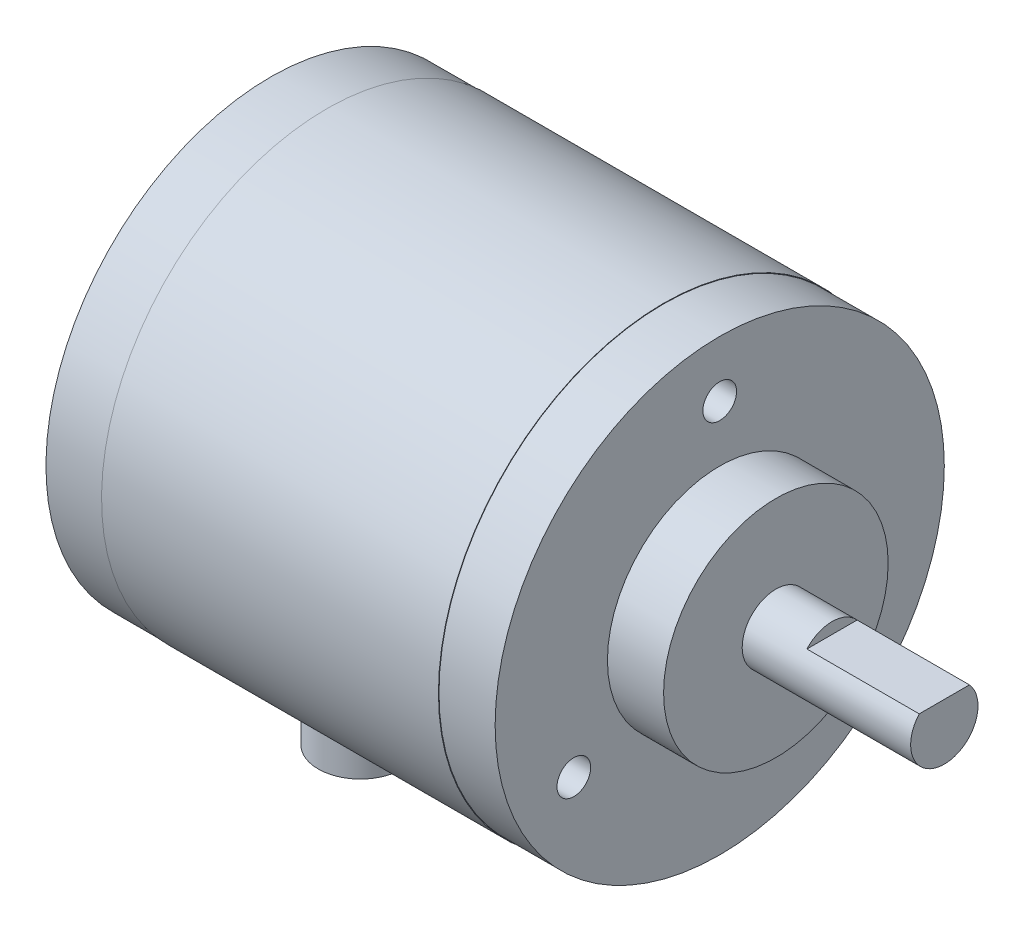
from build123d import *

# Parameters (mm, degrees)
CROQUIS1_R                  = 20
SALIENTE_EXTRUIR1_DEPTH     = 40
CROQUIS2_R                  = 10
SALIENTE_EXTRUIR2_DEPTH     = 5
CROQUIS4_R                  = 1.5
CORTAR_EXTRUIR1_DEPTH       = 5
CROQUIS5_R                  = 3
SALIENTE_EXTRUIR3_DEPTH     = 15
CORTAR_EXTRUIR2_START       = -10
CORTAR_EXTRUIR2_DEPTH       = 10
SALIENTE_EXTRUIR4_START     = -27.5
SALIENTE_EXTRUIR4_OUTLINE_R = 3.75
SALIENTE_EXTRUIR4_DEPTH     = 7.854707334
SALIENTE_EXTRUIR4_START_2   = 3
SALIENTE_EXTRUIR4_2_DEPTH   = 10
SALIENTE_EXTRUIR6_START     = 5
SALIENTE_EXTRUIR6_OUTLINE_R = 20.05
SALIENTE_EXTRUIR6_DEPTH     = 30


with BuildPart() as part:
    # Croquis1 → Saliente-Extruir1 (new body)
    with BuildSketch(Plane(origin=(0, 0, 0), x_dir=(0, 0, -1), z_dir=(1, 0, 0))):
        Circle(CROQUIS1_R)
    extrude(amount=SALIENTE_EXTRUIR1_DEPTH)

    # Croquis2 → Saliente-Extruir2 (add)
    with BuildSketch(Plane(origin=(40, 0, 0), x_dir=(0, 0, -1), z_dir=(1, 0, 0))):
        Circle(CROQUIS2_R)
    extrude(amount=SALIENTE_EXTRUIR2_DEPTH)

    # Croquis4 → Cortar-Extruir1 (cut)
    with BuildSketch(Plane(origin=(40, 0, 0), x_dir=(0, 0, -1), z_dir=(1, 0, 0))):
        with Locations((0, 15)):
            Circle(CROQUIS4_R)
        with Locations((12.990381057, -7.5)):
            Circle(CROQUIS4_R)
        with Locations((-12.990381057, -7.5)):
            Circle(CROQUIS4_R)
    extrude(amount=-CORTAR_EXTRUIR1_DEPTH, mode=Mode.SUBTRACT)

    # Croquis5 → Saliente-Extruir3 (add)
    with BuildSketch(Plane(origin=(45, 0, 0), x_dir=(0, 0, -1), z_dir=(1, 0, 0))):
        Circle(CROQUIS5_R)
    extrude(amount=SALIENTE_EXTRUIR3_DEPTH)

    # Croquis6 → Cortar-Extruir2 (cut)
    with BuildSketch(Plane(origin=(60, 0, 0), x_dir=(0, 0, -1), z_dir=(1, 0, 0)).offset(CORTAR_EXTRUIR2_START)):
        with BuildLine():
            Line((0, 2), (-2.236067977, 2))
            ThreePointArc((-2.236067977, 2), (0, 3), (2.236067977, 2))
            Line((2.236067977, 2), (0, 2))
        make_face()
    extrude(amount=CORTAR_EXTRUIR2_DEPTH, mode=Mode.SUBTRACT)



with BuildPart() as body_2:
    # Saliente-Extruir4: read off the stored shape, not the designer's step
    # Saliente-Extruir4 outline → Saliente-Extruir4 (new body)
    with BuildSketch(Plane(origin=(0, 0, 0), x_dir=(1, 0, 0), z_dir=(0, 1, 0)).offset(SALIENTE_EXTRUIR4_START)):
        with Locations((8, 0)):
            Circle(SALIENTE_EXTRUIR4_OUTLINE_R)
    extrude(amount=SALIENTE_EXTRUIR4_DEPTH)

    # Saliente-Extruir4 2 outline → Saliente-Extruir4 2 (cut)
    with BuildSketch(Plane.YZ.offset(SALIENTE_EXTRUIR4_START_2)):
        with BuildLine():
            ThreePointArc((-19.645292078, 3.749999888), (-20, 0), (-19.645292078, -3.749999888))
            Line((-19.645292078, -3.749999888), (-19.645292078, 3.749999888))
        make_face()
    extrude(amount=SALIENTE_EXTRUIR4_2_DEPTH, mode=Mode.SUBTRACT)


with BuildPart() as part_1:
    add(part.part)

    add(body_2.part)  # Saliente-Extruir6 merges body 2
    # Saliente-Extruir6: read off the stored shape, not the designer's step
    # Saliente-Extruir6 outline → Saliente-Extruir6 (add)
    with BuildSketch(Plane.YZ.offset(SALIENTE_EXTRUIR6_START)):
        Circle(SALIENTE_EXTRUIR6_OUTLINE_R)
        with BuildLine():
            ThreePointArc((-19.645240114, 3.750272106), (20, -7.213e-06), (-19.645242819, -3.750257935))
            ThreePointArc((-19.645242819, -3.750257935), (-20, 7.213e-06), (-19.645240114, 3.750272106))
        make_face(mode=Mode.SUBTRACT)
    extrude(amount=SALIENTE_EXTRUIR6_DEPTH)


solid = part_1.part
